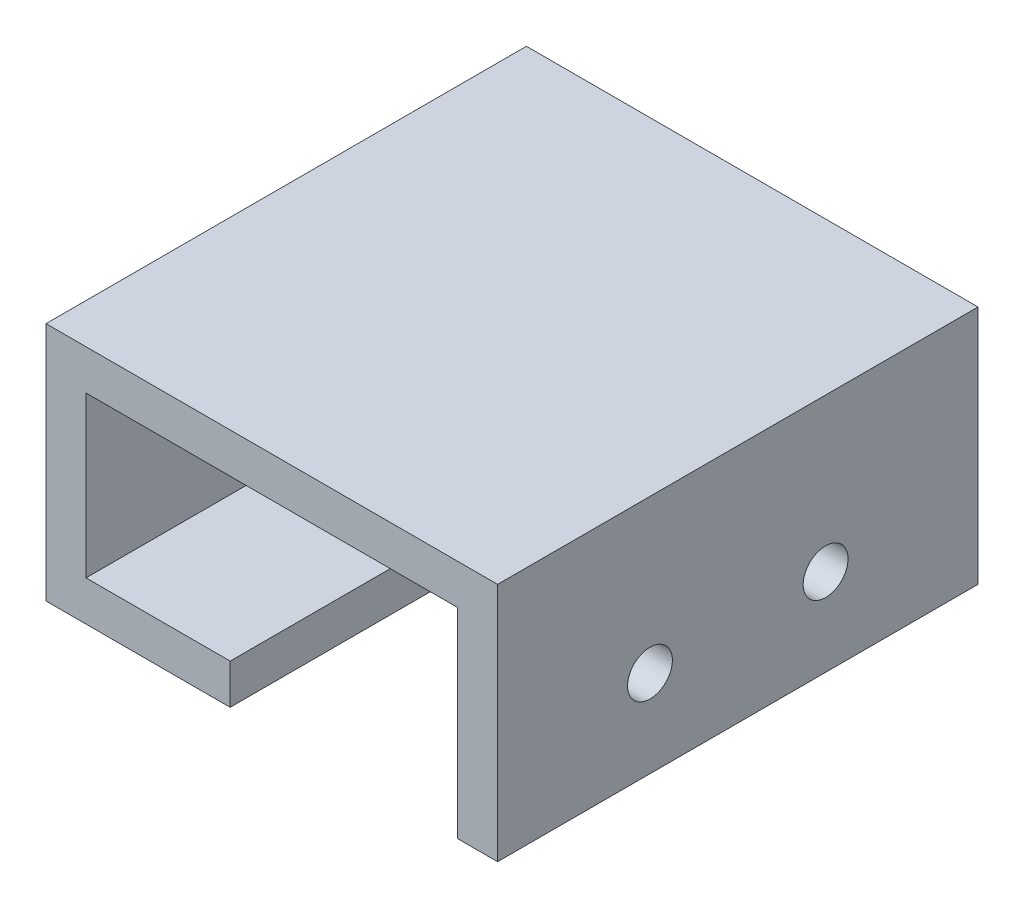
from build123d import *

# Parameters (mm, degrees)
BOSS_EXTRUDE1_DEPTH = 38.1
SKETCH2_R           = 1.778
CUT_EXTRUDE1_DEPTH  = 15.24
SKETCH3_R           = 1.778
CUT_EXTRUDE2_DEPTH  = 15.24


with BuildPart() as part:
    # Sketch1 → Boss-Extrude1 (new body)
    with BuildSketch(Plane.XY):
        Polygon((0, 0), (0, 19.05), (-35.814, 19.05), (-35.814, 0), (-21.209, 0), (-21.209, 3.175), (-32.639, 3.175), (-32.639, 15.875), (-3.175, 15.875), (-3.175, 0), align=None)
    extrude(amount=-BOSS_EXTRUDE1_DEPTH)

    # Sketch2 → Cut-Extrude1 (cut)
    with BuildSketch(Plane(origin=(0, 0, 0), x_dir=(0, 0, -1), z_dir=(1, 0, 0))):
        with Locations((26.0140958, 6.91388)):
            Circle(SKETCH2_R)
        with Locations((12.0859042, 6.91388)):
            Circle(SKETCH2_R)
    extrude(amount=-CUT_EXTRUDE1_DEPTH, mode=Mode.SUBTRACT)

    # Sketch3 → Cut-Extrude2 (cut)
    with BuildSketch(Plane(origin=(0, 0, 0), x_dir=(-1, 0, 0), z_dir=(0, -1, 0))):
        with Locations((26.543, 19.05)):
            Circle(SKETCH3_R)
    extrude(amount=-CUT_EXTRUDE2_DEPTH, mode=Mode.SUBTRACT)


solid = part.part
